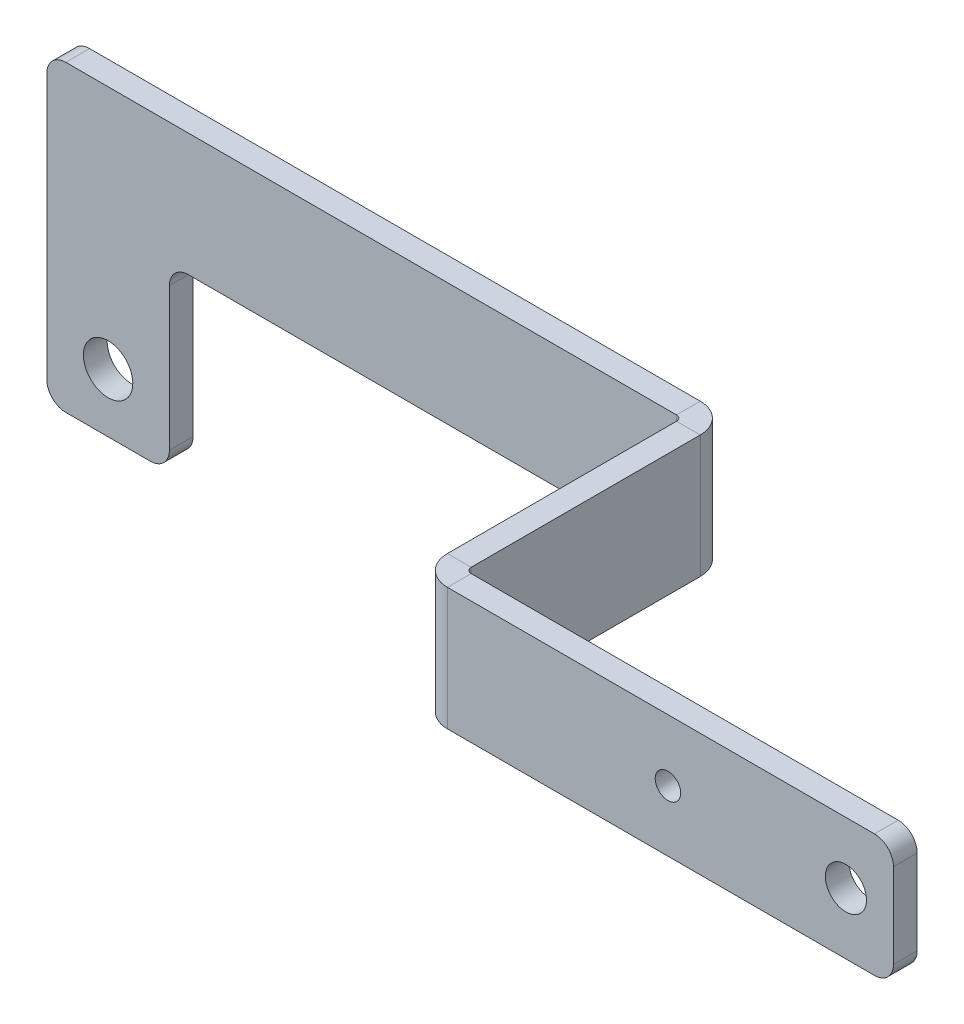
from build123d import *

# Parameters (mm, degrees)
BASE_FLANGE1_DEPTH           = 3.175
EDGE_FLANGE1_DEPTH           = 16.378
EDGE_FLANGE2_STRIP_W         = 14.1732
EDGE_FLANGE2_STRIP_H         = 3.175
EDGE_FLANGE2_STRIP_CUT_DEPTH = 16.378
EDGE_FLANGE2_DEPTH           = 16.378
M5_CLEARANCE_HOLE1_D         = 5.5
M6_CLEARANCE_HOLE1_D         = 6.6
FILLET1_R                    = 2.54
M3_CLEARANCE_HOLE1_D         = 3.4


# Sheet-metal steps are written as plain solids
with BuildPart() as part:
    # Sketch1 → Base-Flange1 (new body)
    with BuildSketch(Plane.XY):
        Polygon((-22.215900005, -29.184600001), (-22.215900005, -69.692600001), (-5.837899995, -69.692600001), (-5.837899995, -45.562600001), (61.9125, -45.562600001), (61.9125, -29.184600001), align=None)
    extrude(amount=-BASE_FLANGE1_DEPTH)

    # Edge-Flange1 section (across the edge) → Edge-Flange1 (add)
    with BuildSketch(Plane(origin=(62.6491, -45.562600001, 0), x_dir=(-1, 0, 0), z_dir=(0, 1, 0))):
        with BuildLine():
            Line((-3.175, 0.7366), (-3.175, 32.0779))
            Line((-3.175, 32.0779), (0, 32.0779))
            Line((0, 32.0779), (0, 0.7366))
            ThreePointArc((0, 0.7366), (0.215745145, 0.215745145), (0.7366, 0))
            Line((0.7366, 0), (0.7366, -3.175))
            ThreePointArc((0.7366, -3.175), (-2.029318885, -2.029318885), (-3.175, 0.7366))
        make_face()
    extrude(amount=EDGE_FLANGE1_DEPTH)

    # Edge-Flange2 strip (across the edge) → Edge-Flange2 strip cut (cut)
    with BuildSketch(Plane(origin=(65.8241, -29.184600001, 32.0779), x_dir=(0, 0, -1), z_dir=(0, -1, 0))):
        with Locations((-6.35, -1.5875)):
            Rectangle(EDGE_FLANGE2_STRIP_W, EDGE_FLANGE2_STRIP_H)
    extrude(amount=EDGE_FLANGE2_STRIP_CUT_DEPTH, mode=Mode.SUBTRACT)

    # Edge-Flange2 section (across the edge) → Edge-Flange2 (add)
    with BuildSketch(Plane(origin=(65.8241, -29.184600001, 32.0779), x_dir=(0, 0, -1), z_dir=(0, -1, 0))):
        with BuildLine():
            Line((-3.175, 0.7366), (-3.175, 60.325))
            Line((-3.175, 60.325), (0, 60.325))
            Line((0, 60.325), (0, 0.7366))
            ThreePointArc((0, 0.7366), (0.215745145, 0.215745145), (0.7366, 0))
            Line((0.7366, 0), (0.7366, -3.175))
            ThreePointArc((0.7366, -3.175), (-2.029318885, -2.029318885), (-3.175, 0.7366))
        make_face()
    extrude(amount=EDGE_FLANGE2_DEPTH)

    # M5 Clearance Hole1 (through all)
    with Locations(Plane.XY.offset(35.2529)):
        with Locations((119.7991, -37.373600001)):
            Hole(M5_CLEARANCE_HOLE1_D / 2)

    # M6 Clearance Hole1 (through all)
    with Locations(Plane.XY):
        with Locations((-14.0269, -61.865600001)):
            Hole(M6_CLEARANCE_HOLE1_D / 2)

    # Fillet1
    fillet1_edges = [part.edges().sort_by_distance(p)[0] for p in [
        (-22.215900005, -69.692600001, -1.5875),
        (-22.215900005, -29.184600001, -1.5875),
        (-5.837899995, -45.562600001, -1.5875),
        (-5.837899995, -69.692600001, -1.5875),
        (126.1491, -29.184600001, 33.6654),
        (126.1491, -45.562600001, 33.6654),
    ]]
    fillet(fillet1_edges, radius=FILLET1_R)

    # M3 Clearance Hole1 (through all)
    with Locations(Plane.XY.offset(35.2529)):
        with Locations((96.0232, -37.423600001)):
            Hole(M3_CLEARANCE_HOLE1_D / 2)


solid = part.part
